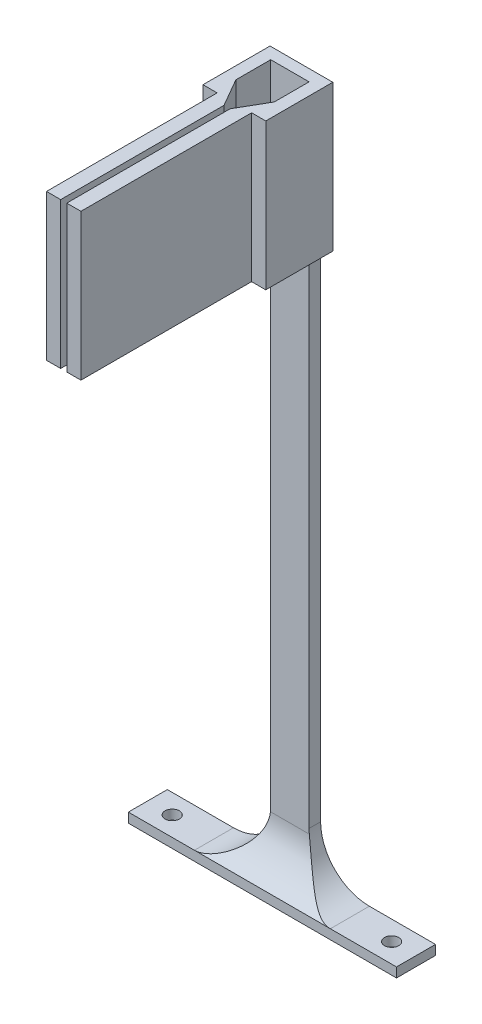
from build123d import *
from build123d.topology import SkipClean

# Parameters (mm, degrees)
SKETCH1_W           = 10
SKETCH1_H           = 170.55
SKETCH1_R           = 2.5
BOSS_EXTRUDE1_DEPTH = 2
SKETCH2_W           = 10
SKETCH2_H           = 170.55
SKETCH2_R           = 2.95
BOSS_EXTRUDE2_DEPTH = 1
SKETCH3_W           = 69.85
SKETCH3_H           = 10.16
SKETCH3_R           = 1.86055
BOSS_EXTRUDE3_DEPTH = 2.5
FILLET1_START       = -1
FILLET1_DEPTH       = 10.16
FILLET1_START_2     = -17.7000001
FILLET1_2_DEPTH     = 35.4000001
FILLET1_START_3     = -5
FILLET1_3_DEPTH     = 10
SKETCH4_W           = 10
SKETCH4_H           = 13.05
BOSS_EXTRUDE4_DEPTH = 3
SKETCH4_3_W         = 3.175
SKETCH4_3_H         = 38.1
BOSS_EXTRUDE5_DEPTH = 11.1125
SKETCH5_W           = 7.38125
SKETCH5_H           = 38.1
BOSS_EXTRUDE6_DEPTH = 50.8
SKETCH6_W           = 3.690625
SKETCH6_H           = 38.1
CUT_EXTRUDE1_DEPTH  = 44.45
CHAMFER1_SIZE       = 4.7625
CHAMFER1_SIZE_2     = 8.248891971


with BuildPart() as part:
    # Sketch1 → Boss-Extrude1 (new body)
    with BuildSketch(Plane.XY):
        with Locations((0, 3)):
            Rectangle(SKETCH1_W, SKETCH1_H)
        with Locations((0, 82.275)):
            Circle(SKETCH1_R, mode=Mode.SUBTRACT)
    extrude(amount=BOSS_EXTRUDE1_DEPTH)

    # Sketch2 → Boss-Extrude2 (add)
    with BuildSketch(Plane(origin=(0, 0, 0), x_dir=(-1, 0, 0), z_dir=(0, 0, -1))):
        with Locations((0, 3)):
            Rectangle(SKETCH2_W, SKETCH2_H)
        with Locations((0, 82.275)):
            Circle(SKETCH2_R, mode=Mode.SUBTRACT)
    extrude(amount=BOSS_EXTRUDE2_DEPTH)

    # Sketch3 → Boss-Extrude3 (add)
    with BuildSketch(Plane.XZ.offset(82.275)):
        with Locations((0, 4.08)):
            Rectangle(SKETCH3_W, SKETCH3_H)
        with Locations(Location((28.575, 4.08, 0), (0, 0, 270))):
            Circle(SKETCH3_R, mode=Mode.SUBTRACT)
        with Locations(Location((-28.575, 4.08, 0), (0, 0, 270))):
            Circle(SKETCH3_R, mode=Mode.SUBTRACT)
    extrude(amount=-BOSS_EXTRUDE3_DEPTH)

    # Fillet1: read off the stored shape, not the designer's step
    # Fillet1 outline → Fillet1 (add)
    with BuildSketch(Plane.XY.offset(FILLET1_START)):
        with BuildLine():
            Line((5, -79.775), (17.7, -79.775))
            ThreePointArc((17.7, -79.775), (8.719743879, -76.055256121), (5, -67.075))
            Line((5, -67.075), (5, -79.775))
        make_face()
        with BuildLine():
            Line((-17.7, -79.775), (-5, -79.775))
            Line((-5, -79.775), (-5, -67.075))
            ThreePointArc((-5, -67.075), (-8.719743879, -76.055256121), (-17.7, -79.775))
        make_face()
    extrude(amount=FILLET1_DEPTH)

    # Fillet1 2 outline → Fillet1 2 (cut)
    with BuildSketch(Plane.YZ.offset(FILLET1_START_2)):
        with BuildLine():
            Line((-66, 9.16), (-79.775009155, 9.160018885))
            ThreePointArc((-79.775009155, 9.160018885), (-75.089891257, 3.937849653), (-68.347034302, 2))
            Line((-68.347034302, 2), (-66, 2))
            Line((-66, 2), (-66, 9.16))
        make_face()
    extrude(amount=FILLET1_2_DEPTH, mode=Mode.SUBTRACT)

    # Fillet1 3 outline → Fillet1 3 (add)
    with SkipClean():  # the faces are left unmerged after this step: merging them gives an invalid solid
        with BuildSketch(Plane.YZ.offset(FILLET1_START_3)):
            with BuildLine():
                ThreePointArc((-68.347034302, 2), (-75.089891257, 3.937849653), (-79.775009155, 9.160018885))
                Line((-79.775009155, 9.160018885), (-79.775, 0))
                Line((-79.775, 0), (-66, 0))
                Line((-66, 0), (-66, 2))
                Line((-66, 2), (-68.347034302, 2))
            make_face()
        extrude(amount=FILLET1_3_DEPTH)
    add(part.part.scale(1), mode=Mode.REPLACE)  # the faces are merged on a copy

    # Sketch4 → Boss-Extrude4 (add)
    with SkipClean():  # the faces are left unmerged after this step: merging them gives an invalid solid
        with BuildSketch(Plane(origin=(0, 0, -1), x_dir=(-1, 0, 0), z_dir=(0, 0, -1))):
            Polygon((8.175, 63.225), (8.175, 101.325), (5, 101.325), (5, 88.275), (5, 63.225), align=None)
            with Locations((0, 94.8)):
                Rectangle(SKETCH4_W, SKETCH4_H)
            Polygon((-5, 88.275), (-5, 101.325), (-8.175, 101.325), (-8.175, 63.225), (-5, 63.225), align=None)
        extrude(amount=-BOSS_EXTRUDE4_DEPTH)

    # Sketch4<3> → Boss-Extrude5 (add)
    with SkipClean():  # the faces are left unmerged after this step: merging them gives an invalid solid
        with BuildSketch(Plane(origin=(0, 0, -1), x_dir=(-1, 0, 0), z_dir=(0, 0, -1))):
            with Locations((6.5875, 82.275)):
                Rectangle(SKETCH4_3_W, SKETCH4_3_H)
            with Locations((-6.5875, 82.275)):
                Rectangle(SKETCH4_3_W, SKETCH4_3_H)
        extrude(amount=-BOSS_EXTRUDE5_DEPTH)

    # Sketch5 → Boss-Extrude6 (add)
    with SkipClean():  # the faces are left unmerged after this step: merging them gives an invalid solid
        with BuildSketch(Plane.XY.offset(10.1125)):
            with Locations((-4.484375, 82.275)):
                Rectangle(SKETCH5_W, SKETCH5_H)
            with Locations((4.484375, 82.275)):
                Rectangle(SKETCH5_W, SKETCH5_H)
        extrude(amount=BOSS_EXTRUDE6_DEPTH)

    # Sketch6 → Cut-Extrude1 (cut)
    with SkipClean():  # the faces are left unmerged after this step: merging them gives an invalid solid
        with BuildSketch(Plane.XY.offset(60.9125)):
            with Locations((-6.3296875, 82.275)):
                Rectangle(SKETCH6_W, SKETCH6_H)
            with Locations((6.3296875, 82.275)):
                Rectangle(SKETCH6_W, SKETCH6_H)
        extrude(amount=-CUT_EXTRUDE1_DEPTH, mode=Mode.SUBTRACT)

    # Chamfer1
    # the kernel refuses this chamfer: 8.248891971, 4.7625 mm, written as the material it takes off along each edge
    with BuildSketch(Plane(origin=(-0.79375, 122.66559091, 10.1125), x_dir=(-1, 0, 0), z_dir=(0, -1, 0))) as chamfer1_piece_1_section:
        Polygon((CHAMFER1_SIZE, 0), (0, -CHAMFER1_SIZE_2), (0, 0), align=None)
    chamfer1_piece_1 = extrude(amount=80.78118182, mode=Mode.PRIVATE)
    chamfer1_piece_1 = split(chamfer1_piece_1, bisect_by=Plane(origin=(-5, 122.66559091, 10.1125), z_dir=(1, 0, 0)), keep=Keep.TOP, mode=Mode.PRIVATE)
    add(chamfer1_piece_1, mode=Mode.SUBTRACT)
    with BuildSketch(Plane(origin=(0.79375, 122.66559091, 10.1125), x_dir=(1, 0, 0), z_dir=(0, -1, 0))) as chamfer1_piece_2_section:
        Polygon((CHAMFER1_SIZE, 0), (0, CHAMFER1_SIZE_2), (0, 0), align=None)
    chamfer1_piece_2 = extrude(amount=80.78118182, mode=Mode.PRIVATE)
    chamfer1_piece_2 = split(chamfer1_piece_2, bisect_by=Plane(origin=(5, 122.66559091, 10.1125), z_dir=(-1, 0, 0)), keep=Keep.TOP, mode=Mode.PRIVATE)
    add(chamfer1_piece_2, mode=Mode.SUBTRACT)


solid = part.part
